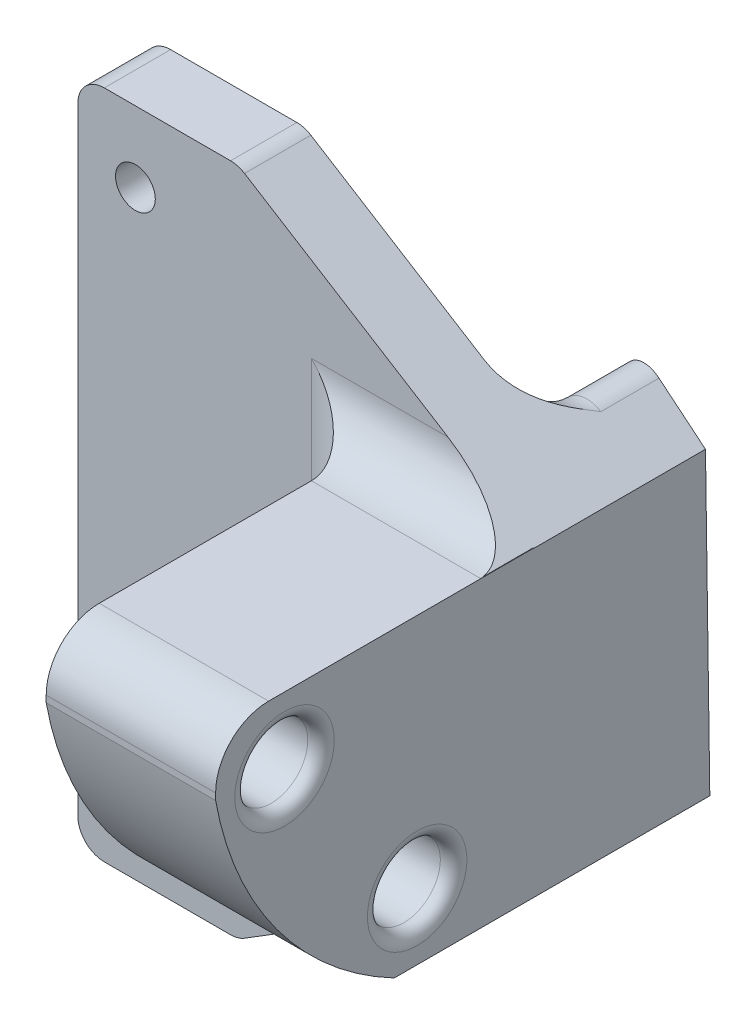
from build123d import *

# Parameters (mm, degrees)
SKETCH2_R           = 0.7500000000000004
BOSS_EXTRUDE1_DEPTH = 2.5
BOSS_EXTRUDE2_DEPTH = 12
CUT_EXTRUDE1_DEPTH  = 26.80060102058964
SKETCH6_R           = 1.3749999999999991
CUT_EXTRUDE2_DEPTH  = 4
SKETCH7_R           = 0.7500000000000003
CUT_EXTRUDE3_DEPTH  = 3
FILLET1_R           = 2
BOSS_EXTRUDE3_REACH = 26.407
FILLET2_R           = 1
FILLET3_R           = 2
FILLET4_R           = 0.5
FILLET5_R           = 2
BOSS_EXTRUDE4_DEPTH = 1
FILLET6_R           = 1


with BuildPart() as part:
    # Sketch2 → Boss-Extrude1 (new body)
    with BuildSketch(Plane.XY):
        with BuildLine():
            Line((4.116231300669973, -12.487470539218611), (15.02453653918129, -5.7))
            Line((15.02453653918129, -5.7), (15.02453653918129, 5.7))
            Line((15.02453653918129, 5.7), (4.116231300669971, 12.48747053921861))
            ThreePointArc((4.116231300669971, 12.48747053921861), (3.862648579708159, 12.599939965816992), (3.587924890573724, 12.638416749961875))
            Line((3.587924890573724, 12.638416749961875), (-1.1711441707508923, 12.638416749961877))
            ThreePointArc((-1.1711441707508923, 12.638416749961877), (-1.8782509519374466, 12.345523531148423), (-2.1711441707508996, 11.63841674996187))
            Line((-2.1711441707508996, 11.63841674996187), (-2.1711441707508996, -11.638416749961872))
            ThreePointArc((-2.1711441707508996, -11.638416749961872), (-1.8782509519374468, -12.345523531148427), (-1.1711441707508923, -12.638416749961879))
            Line((-1.1711441707508923, -12.638416749961879), (3.5879248905737255, -12.638416749961879))
            ThreePointArc((3.5879248905737255, -12.638416749961879), (3.862648579708161, -12.599939965816995), (4.116231300669973, -12.487470539218611))
        make_face()
        with Locations((0, -9.97035341926017)):
            Circle(SKETCH2_R, mode=Mode.SUBTRACT)
        with Locations((3.47e-15, 9.97035341926017)):
            Circle(SKETCH2_R, mode=Mode.SUBTRACT)
    extrude(amount=BOSS_EXTRUDE1_DEPTH)

    # Sketch3 → Boss-Extrude2 (add)
    with BuildSketch(Plane.XY.offset(2.5)):
        Polygon((8.635867339785385, 5.711084969162394), (15.02453653918129, 5.711084969162394), (15.02453653918129, -5.7), (8.635867339785387, -5.7), align=None)
    extrude(amount=BOSS_EXTRUDE2_DEPTH)

    # Sketch5 → Cut-Extrude1 (cut, through all)
    with BuildSketch(Plane(origin=(15.02453653918129, 0, 0), x_dir=(0, 0, -1), z_dir=(1, 0, 0))):
        with BuildLine():
            Line((-7.762268701086982, -5.7), (-14.5, -5.7))
            Line((-14.5, -5.7), (-14.5, 3.4648563911354757))
            ThreePointArc((-14.5, 3.4648563911354757), (-12.192953898035139, -1.8981901244151027), (-7.762268701086982, -5.7))
        make_face()
    extrude(amount=-CUT_EXTRUDE1_DEPTH, mode=Mode.SUBTRACT)

    # Sketch6 → Cut-Extrude2 (cut)
    with BuildSketch(Plane(origin=(15.02453653918129, 0, 0), x_dir=(0, 0, -1), z_dir=(1, 0, 0))):
        with Locations((-6.900000000000064, -3.2)):
            Circle(SKETCH6_R)
        with Locations((-11.900000000000077, 3.2)):
            Circle(SKETCH6_R)
    extrude(amount=-CUT_EXTRUDE2_DEPTH, mode=Mode.SUBTRACT)

    # Sketch7 → Cut-Extrude3 (cut)
    with BuildSketch(Plane(origin=(11.02453653918129, 0, 0), x_dir=(0, 0, -1), z_dir=(1, 0, 0))):
        with Locations((-11.900000000000077, 3.2)):
            Circle(SKETCH7_R)
        with Locations((-6.900000000000064, -3.2)):
            Circle(SKETCH7_R)
    extrude(amount=-CUT_EXTRUDE3_DEPTH, mode=Mode.SUBTRACT)

    # Fillet1
    fillet1_edges = [part.edges().sort_by_distance(p)[0] for p in [
        (11.821294480770684, 5.711084969162394, 2.5),
        (8.635867339785385, 0.00554248458119755, 2.5),
        (11.830201939483338, -5.7, 2.5),
    ]]
    fillet(fillet1_edges, radius=FILLET1_R)

    # Boss-Extrude3: up to this plane
    boss_extrude3_end = Plane(origin=(0.6918614114138348, 0.08281182310567678, -5.770631561455755), z_dir=(-0.11902892958542202, -0.014247076796988894, 0.99278856496461))
    # Sketch8 → Boss-Extrude3 (add, up to the surface)
    with BuildSketch(Plane(origin=(0, 0, 0), x_dir=(-1, 0, 0), z_dir=(0, 0, -1)), mode=Mode.PRIVATE) as boss_extrude3_sk1:
        Polygon((-11.52453653918129, 7.877803642988929), (-11.524536539181288, -7.877803642988929), (-15.02453653918129, -5.7), (-15.02453653918129, 5.7), align=None)
    boss_extrude3_tool1 = split(extrude(boss_extrude3_sk1.sketch, amount=BOSS_EXTRUDE3_REACH, mode=Mode.PRIVATE), bisect_by=boss_extrude3_end, keep=Keep.BOTH, mode=Mode.PRIVATE)
    add(boss_extrude3_tool1.solids().sort_by_distance((13.180973, 0, 0))[0])

    # Fillet2
    fillet2_edges = [part.edges().sort_by_distance(p)[0] for p in [
        (11.524536539181288, -7.877803642988929, -2.293051593463615),
        (11.52453653918129, 7.877803642988929, -2.1800006605116793),
    ]]
    fillet(fillet2_edges, radius=FILLET2_R)

    # Fillet3
    # the kernel refuses this fillet: 2 mm, written as the material it adds along each edge
    with BuildSketch(Plane(origin=(11.52453653918129, 6.077792348729071, 0), x_dir=(0, 0, -1), z_dir=(-1.1e-16, -1, 0))) as fillet3_piece_1:
        with BuildLine():
            CenterArc((FILLET3_R, -FILLET3_R), FILLET3_R, 90, 90)
            Line((-2.2e-16, -FILLET3_R), (0, 0))
            Line((0, 0), (FILLET3_R, 0))
        make_face()
    extrude(amount=12.155584697458142)
    with BuildSketch(Plane(origin=(12.524536539181288, 6.077792348729071, 0), x_dir=(-0.9999802608561372, -0.0062831439655592885, 0), z_dir=(-0.0062831439655592885, 0.9999802608561372, 0))) as fillet3_piece_2_section:
        with BuildLine():
            CenterArc((-1.0000000000000004 - FILLET3_R, -FILLET3_R), FILLET3_R, 0, 90)
            Line((-1.0000000000000004 - FILLET3_R, 2.2e-16), (-1.0000000000000004, 0))
            Line((-1.0000000000000004, 0), (-1.0000000000000004, -FILLET3_R))
        make_face()
    fillet3_piece_2 = revolve(axis=Axis((12.524536539181288, 6.077792348729071, 0), (0, 0, 1)), revolution_arc=359.64, mode=Mode.PRIVATE)
    fillet3_piece_2 = split(fillet3_piece_2, bisect_by=Plane(origin=(15.02453653918129, 7.1019861013756325, -0.5901681133498685), z_dir=(-1, 0, 0)), keep=Keep.TOP, mode=Mode.PRIVATE)
    fillet3_piece_2 = split(fillet3_piece_2, bisect_by=Plane(origin=(12.183247296711823, 7.467934303724357, -0.5901681133498685), z_dir=(-0.5283064100962469, -0.8490537892567327, 0)), keep=Keep.TOP, mode=Mode.PRIVATE)
    add(fillet3_piece_2)
    with BuildSketch(Plane(origin=(12.524536539181288, -6.077792348729071, 0), x_dir=(-0.9999802608561372, 0.0062831439655592885, 0), z_dir=(-0.0062831439655592885, -0.9999802608561372, 0))) as fillet3_piece_3_section:
        with BuildLine():
            CenterArc((-1.0000000000000004 - FILLET3_R, FILLET3_R), FILLET3_R, 270, 89.99999999999999)
            Line((-1.0000000000000004, FILLET3_R), (-1.0000000000000004, 0))
            Line((-1.0000000000000004, 0), (-1.0000000000000004 - FILLET3_R, 0))
        make_face()
    fillet3_piece_3 = revolve(axis=Axis((12.524536539181288, -6.077792348729071, 0), (0, 0, -1)), revolution_arc=359.64, mode=Mode.PRIVATE)
    fillet3_piece_3 = split(fillet3_piece_3, bisect_by=Plane(origin=(12.183247362657765, -7.46793426269084, -0.5901681133823713), z_dir=(-0.528306410096247, 0.8490537892567326, 0)), keep=Keep.TOP, mode=Mode.PRIVATE)
    fillet3_piece_3 = split(fillet3_piece_3, bisect_by=Plane(origin=(15.02453653918129, -7.101986179070657, -0.5901681133823713), z_dir=(-1, 0, 0)), keep=Keep.TOP, mode=Mode.PRIVATE)
    add(fillet3_piece_3)

    # Fillet4
    fillet4_edges = [part.edges().sort_by_distance(p)[0] for p in [
        (15.02453653918129, -3.1999999999999993, 8.275000000000063),
        (15.02453653918129, 3.200000000000001, 13.275000000000077),
        (8.635867339785387, 3.2, 12.650000000000077),
        (8.635867339785387, -3.2, 7.650000000000064),
    ]]
    fillet(fillet4_edges, radius=FILLET4_R)

    # Fillet5
    fillet5_edges = [part.edges().sort_by_distance(p)[0] for p in [
        (11.830201939483338, 5.711084969162394, 14.5),
    ]]
    fillet(fillet5_edges, radius=FILLET5_R)

    # Sketch9 → Boss-Extrude4 (add, symmetric)
    with BuildSketch(Plane(origin=(0, 0, 0), x_dir=(1, 0, 0), z_dir=(0, 1, 0))):
        Polygon((13.64406676847059, 3.2259337507926826), (11.690763161789368, 3.2259337507926826), (5.025114603989698, -0.41209421665109464), (13.155740866800285, -0.41209421665109464), align=None)
    extrude(amount=BOSS_EXTRUDE4_DEPTH, both=True)

    # Fillet6
    fillet6_edges = [part.edges().sort_by_distance(p)[0] for p in [
        (10.938750101554096, -1, -0.5857864376269046),
        (10.938750101554096, 1, -0.5857864376269046),
        (11.524536539181288, 1, -2.5676046651974334),
        (7.652348125765714, -1, 0),
        (7.652348125765714, 1, 0),
        (11.524536539181288, -1.0000000000000004, -2.567604665197433),
    ]]
    fillet(fillet6_edges, radius=FILLET6_R)


solid = part.part
